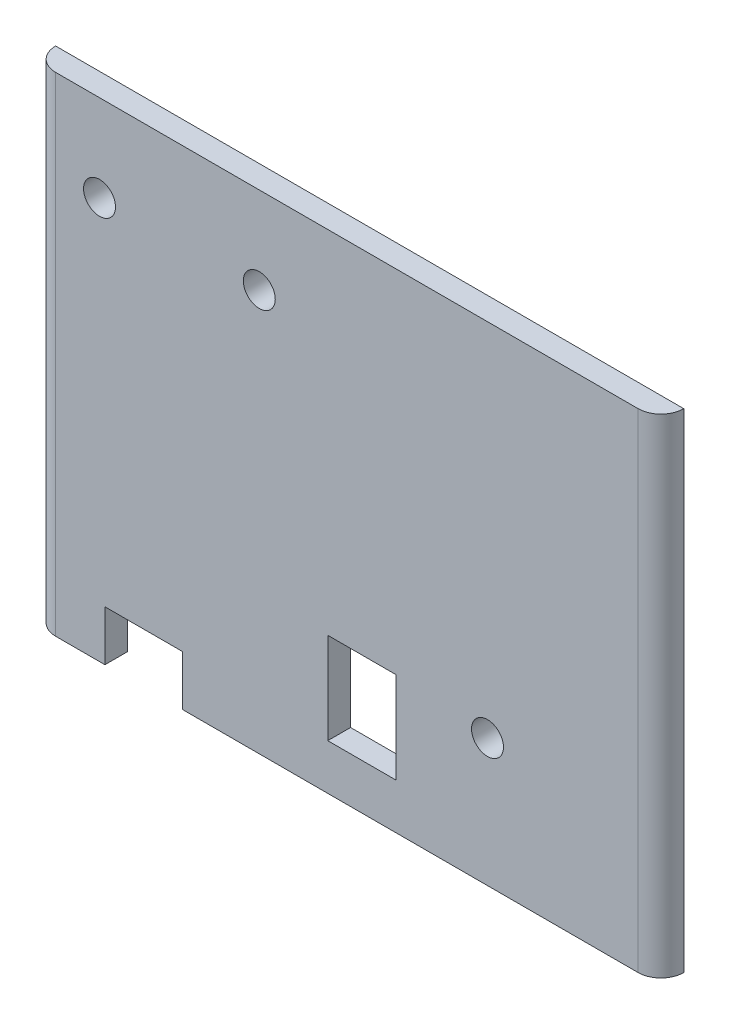
from build123d import *

# Parameters (mm, degrees)
SKETCH1_W                = 150
SKETCH1_H                = 135
SKETCH1_R                = 2.1
BOSS_EXTRUDE2_DEPTH      = 70
SKETCH13_W               = 166.167800453
SKETCH13_H               = 148.934240363
CUT_EXTRUDE1_DEPTH       = 60
SKETCH17_W               = 17
SKETCH17_H               = 11
SKETCH17_W_2             = 15
SKETCH17_H_2             = 20
CUT_EXTRUDE5_DEPTH       = 10
CUT_EXTRUDE6_DEPTH       = 203.051973512
CUT_EXTRUDE6_DEPTH_BACK  = 203.051973512
SKETCH18_W               = 150
SKETCH18_H               = 135
CUT_EXTRUDE7_DEPTH       = 206.095744471
CUT_EXTRUDE7_DEPTH_BACK  = 206.095744471
FILLET1_R                = 5
SKETCH20_W               = 8
SKETCH20_H               = 8
BOSS_EXTRUDE3_DEPTH      = 3
CUT_EXTRUDE9_START       = -5
SKETCH21_R               = 3.5
SKETCH21_R_2             = 2.1
CUT_EXTRUDE9_DEPTH       = 5
CUT_EXTRUDE10_DEPTH      = 197.81971446
CUT_EXTRUDE10_DEPTH_BACK = 197.81971446
SKETCH21_2_R             = 2.1


with BuildPart() as part:
    # Sketch1 → Boss-Extrude2 (new body)
    with BuildSketch(Plane.XY):
        with Locations((75, 67.5)):
            Rectangle(SKETCH1_W, SKETCH1_H)
        with Locations((20, 116)):
            Circle(SKETCH1_R, mode=Mode.SUBTRACT)
        with Locations((55, 116)):
            Circle(SKETCH1_R, mode=Mode.SUBTRACT)
        with Locations((105, 56)):
            Circle(SKETCH1_R, mode=Mode.SUBTRACT)
    extrude(amount=BOSS_EXTRUDE2_DEPTH)

    # Sketch13 → Cut-Extrude1 (cut)
    with BuildSketch(Plane(origin=(0, 0, 0), x_dir=(-1, 0, 0), z_dir=(0, 0, -1))):
        with Locations((-76.451247165, 67.95351474)):
            Rectangle(SKETCH13_W, SKETCH13_H)
    extrude(amount=-CUT_EXTRUDE1_DEPTH, mode=Mode.SUBTRACT)

    # Sketch17 → Cut-Extrude5 (cut)
    with BuildSketch(Plane.XY.offset(70)):
        with Locations((29.68, 33.5)):
            Rectangle(SKETCH17_W, SKETCH17_H)
        with Locations((77.5, 48)):
            Rectangle(SKETCH17_W_2, SKETCH17_H_2)
    extrude(amount=-CUT_EXTRUDE5_DEPTH, mode=Mode.SUBTRACT)

    # Sketch18 → Cut-Extrude6 (cut, two sides: drawn at the far end of the back side and taken through both)
    # profile 1 of 2: a face of its own
    with BuildSketch(Plane.XY.offset(70).offset(-CUT_EXTRUDE6_DEPTH_BACK)):
        Polygon((-16.428571429, -29.414285714), (-20.085714286, 157.1), (193.857142857, 157.1), (193.857142857, -29.414285714), align=None)
        with Locations((75, 67.5)):
            Rectangle(SKETCH18_W, SKETCH18_H, mode=Mode.SUBTRACT)
    # profile 2 of 2: a face of its own
    with BuildSketch(Plane.XY.offset(70).offset(-CUT_EXTRUDE6_DEPTH_BACK)):
        Polygon((143, 28), (5.38, 28), (5.38, 135), (0, 135), (0, 0), (150, 0), (150, 135), (143, 135), align=None)
    extrude(amount=CUT_EXTRUDE6_DEPTH + CUT_EXTRUDE6_DEPTH_BACK, mode=Mode.SUBTRACT)

    # Sketch19 → Cut-Extrude7 (cut, two sides: drawn at the far end of the back side and taken through both)
    with BuildSketch(Plane(origin=(143, 0, 0), x_dir=(0, 0, -1), z_dir=(1, 0, 0)).offset(-CUT_EXTRUDE7_DEPTH_BACK)):
        Polygon((-65, 138.622751323), (-65, 12.247752415), (-38.78181863, -5.10096745), (-31.852947011, 142.632473856), align=None)
    extrude(amount=CUT_EXTRUDE7_DEPTH + CUT_EXTRUDE7_DEPTH_BACK, mode=Mode.SUBTRACT)

    # Fillet1
    fillet1_edges = [part.edges().sort_by_distance(p)[0] for p in [
        (5.38, 81.5, 70),
        (143, 81.5, 70),
    ]]
    fillet(fillet1_edges, radius=FILLET1_R - 0.0001)  # a hair under: the kernel refuses the full size

    # Sketch20 → Boss-Extrude3 (add)
    with BuildSketch(Plane(origin=(0, 0, 65), x_dir=(-1, 0, 0), z_dir=(0, 0, -1))):
        with Locations((-55, 116)):
            Rectangle(SKETCH20_W, SKETCH20_H)
        with Locations((-20, 116)):
            Rectangle(SKETCH20_W, SKETCH20_H)
        with Locations((-105, 56)):
            Rectangle(SKETCH20_W, SKETCH20_H)
    extrude(amount=BOSS_EXTRUDE3_DEPTH)

    # Sketch21 → Cut-Extrude9 (cut)
    # profile 1 of 3: a face of its own
    with BuildSketch(Plane.XY.offset(70).offset(CUT_EXTRUDE9_START)):
        with Locations((20, 116)):
            Circle(SKETCH21_R)
        with Locations((20, 116)):
            Circle(SKETCH21_R_2, mode=Mode.SUBTRACT)
    # profile 2 of 3: a face of its own
    with BuildSketch(Plane.XY.offset(70).offset(CUT_EXTRUDE9_START)):
        with Locations((55, 116)):
            Circle(SKETCH21_R)
        with Locations((55, 116)):
            Circle(SKETCH21_R_2, mode=Mode.SUBTRACT)
    # profile 3 of 3: a face of its own
    with BuildSketch(Plane.XY.offset(70).offset(CUT_EXTRUDE9_START)):
        with Locations((105, 56)):
            Circle(SKETCH21_R)
        with Locations((105, 56)):
            Circle(SKETCH21_R_2, mode=Mode.SUBTRACT)
    extrude(amount=CUT_EXTRUDE9_DEPTH, mode=Mode.SUBTRACT)

    # Sketch21<2> → Cut-Extrude10 (cut, two sides: drawn at the far end of the back side and taken through both)
    with BuildSketch(Plane.XY.offset(70).offset(-CUT_EXTRUDE10_DEPTH_BACK)):
        with Locations((20, 116)):
            Circle(SKETCH21_2_R)
        with Locations((55, 116)):
            Circle(SKETCH21_2_R)
        with Locations((105, 56)):
            Circle(SKETCH21_2_R)
    extrude(amount=CUT_EXTRUDE10_DEPTH + CUT_EXTRUDE10_DEPTH_BACK, mode=Mode.SUBTRACT)


solid = part.part
